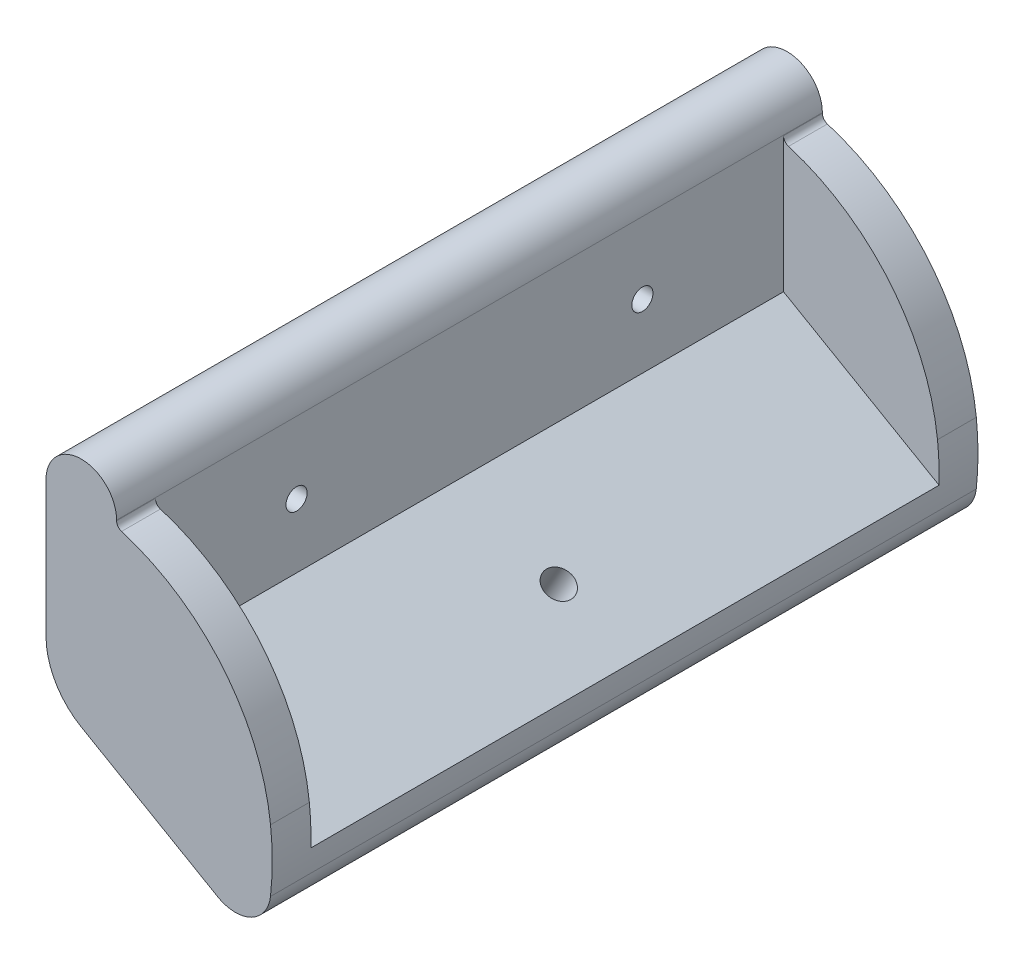
from build123d import *

# Parameters (mm, degrees)
BOSS_EXTRU_1_DEPTH      = 100
ESQUISSE3_R             = 2
ENL_V_MAT_EXTRU_2_DEPTH = 115.052675119
ESQUISSE7_W             = 5.5
ESQUISSE7_H             = 20.980762114
BOSS_EXTRU_3_DEPTH      = 29.226497
BOSS_EXTRU_4_OUTLINE_W  = 5.5
BOSS_EXTRU_4_OUTLINE_H  = 18.169872981
BOSS_EXTRU_4_DEPTH      = 10.490381057
CONG_2_R                = 40
CONG_3_R                = 40
CONG_4_R                = 5
CONG_5_RADIUS           = 5
CONG_5_LENGTH           = 100
ESQUISSE9_R             = 1.5
ENL_V_MAT_EXTRU_3_DEPTH = 112.741489915
CONG_6_R                = 1
CONG_7_R                = 1
CONG_8_R                = 30


# Read off the part's stored shape, not the designer's step: Boss.-Extru.4
with BuildPart() as part:
    # Esquisse1 → Boss.-Extru.1 (new body)
    with BuildSketch(Plane.XY):
        with BuildLine():
            Line((0, 0), (0, -24.226497308))
            ThreePointArc((0, -24.226497308), (1.339745962, -29.226497308), (5, -32.886751346))
            Line((5, -32.886751346), (30.310889132, -47.5))
            Line((30.310889132, -47.5), (35.310889132, -38.839745962))
            Line((35.310889132, -38.839745962), (10, -24.226497308))
            Line((10, -24.226497308), (10, 0))
            Line((10, 0), (0, 0))
        make_face()
    extrude(amount=BOSS_EXTRU_1_DEPTH)

    # Esquisse3 → Enlèv. mat.-Extru.2 (cut, through all)
    with BuildSketch(Plane(origin=(-7.990381057, -13.839745962, 0), x_dir=(0.86602540378444, -0.4999999999999978, 0), z_dir=(0.4999999999999978, 0.86602540378444, 0))):
        with Locations(Location((35.386751346, -50, 0), (0, 0, 180))):
            Circle(ESQUISSE3_R)
    extrude(amount=-ENL_V_MAT_EXTRU_2_DEPTH, mode=Mode.SUBTRACT)

    # Esquisse7 → Boss.-Extru.3 (add)
    with BuildSketch(Plane(origin=(43.301270189, -25, 0), x_dir=(0, 0, -1), z_dir=(0.86602540378444, -0.49999999999999756, 0))):
        with Locations((-97.25, -5.490381057)):
            Rectangle(ESQUISSE7_W, ESQUISSE7_H)
        with Locations((-2.75, -5.490381057)):
            Rectangle(ESQUISSE7_W, ESQUISSE7_H)
    extrude(amount=-BOSS_EXTRU_3_DEPTH)

    # Boss.-Extru.4 outline → Boss.-Extru.4 (add)
    with BuildSketch(Plane(origin=(10, 0, 0), x_dir=(0, 0, -1), z_dir=(1, 0, 0))):
        with Locations((-2.75, -15.141560818)):
            Rectangle(BOSS_EXTRU_4_OUTLINE_W, BOSS_EXTRU_4_OUTLINE_H)
        with Locations((-97.25, -15.141560818)):
            Rectangle(BOSS_EXTRU_4_OUTLINE_W, BOSS_EXTRU_4_OUTLINE_H)
    extrude(amount=BOSS_EXTRU_4_DEPTH)

    # Congé2
    # the kernel refuses this fillet: 40 mm, written as the material it takes off along each edge
    with BuildSketch(Plane(origin=(20.490381057, -6.056624327, 32.29491991), x_dir=(-1, 0, 0), z_dir=(0, 0, -1))) as cong_2_piece_1_section:
        with BuildLine():
            CenterArc((CONG_2_R * 0.267949192431, -CONG_2_R), CONG_2_R, 90, 30)
            Line((-CONG_2_R * 0.232050807569, -CONG_2_R * 0.133974596216), (0, 0))
            Line((0, 0), (CONG_2_R * 0.267949192431, 0))
        make_face()
    cong_2_piece_1 = extrude(amount=59.089839821, mode=Mode.PRIVATE)
    cong_2_piece_1 = split(cong_2_piece_1, bisect_by=Plane(origin=(10, -7.066001807, 2.75), z_dir=(1, 0, 0)), keep=Keep.TOP, mode=Mode.PRIVATE)
    add(cong_2_piece_1, mode=Mode.SUBTRACT)
    with BuildSketch(Plane(origin=(20.490381057, -6.056624327, 67.70508009), x_dir=(-1, 0, 0), z_dir=(0, 0, 1))) as cong_2_piece_2_section:
        with BuildLine():
            CenterArc((CONG_2_R * 0.267949192431, CONG_2_R), CONG_2_R, 240, 30)
            Line((-CONG_2_R * 0.232050807569, CONG_2_R * 0.133974596216), (0, 0))
            Line((0, 0), (CONG_2_R * 0.267949192431, 0))
        make_face()
    cong_2_piece_2 = extrude(amount=59.089839821, mode=Mode.PRIVATE)
    cong_2_piece_2 = split(cong_2_piece_2, bisect_by=Plane(origin=(10, -7.066001807, 97.25), z_dir=(1, 0, 0)), keep=Keep.TOP, mode=Mode.PRIVATE)
    add(cong_2_piece_2, mode=Mode.SUBTRACT)

    # Congé3
    # the kernel refuses this fillet: 40 mm, written as the material it takes off along each edge
    with BuildSketch(Plane(origin=(45.801270189, -20.669872981, -2.92475776), x_dir=(-0.8660254037844402, 0.49999999999999756, 0), z_dir=(0, 0, 1))) as cong_3_piece_1:
        with BuildLine():
            CenterArc((38.969903104, 40), CONG_3_R, 193.031161189, 76.968838811)
            Line((0, 30.980762114), (-0.779398062, 30.800377356))
            ThreePointArc((-0.779398062, 30.800377356), (-0.8, 15.490381057), (-0.8, 0))
            Line((-0.8, 0), (0, -0.8))
            Line((0, -0.8), (38.969903104, -0.8))
            Line((38.969903104, -0.8), (38.969903104, 0))
        make_face()
    extrude(amount=200.349515521, mode=Mode.SUBTRACT)

    # Congé4
    cong_4_edges = [part.edges().sort_by_distance(p)[0] for p in [
        (30.310889132, -47.5, 50),
    ]]
    fillet(cong_4_edges, radius=CONG_4_R)

    # Congé5: full round fillet: the end face becomes a half cylinder, R = half its width
    cong_5_face = Plane((5, 0, 50), x_dir=(0, 0, -1), z_dir=(0, 1, 0))  # on the end face: x along it, z out of the body
    cong_5_slab = cong_5_face.offset(-CONG_5_RADIUS / 2) * Box(CONG_5_LENGTH, 2 * CONG_5_RADIUS, CONG_5_RADIUS, mode=Mode.PRIVATE)  # the body's end, R deep
    cong_5_round = Plane((5, -5, 50), x_dir=(0, 1, 0), z_dir=(0, 0, -1)) * Cylinder(CONG_5_RADIUS, CONG_5_LENGTH, mode=Mode.PRIVATE)  # its axis R under the face
    add(cong_5_slab - cong_5_round, mode=Mode.SUBTRACT)

    # Esquisse9 → Enlèv. mat.-Extru.3 (cut, through all)
    with BuildSketch(Plane(origin=(10, 0, 0), x_dir=(0, 0, -1), z_dir=(1, 0, 0))):
        with Locations(Location((-74.5, -15.141560818, 0), (0, 0, 90))):
            Circle(ESQUISSE9_R)
        with Locations(Location((-25.5, -15.141560818, 0), (0, 0, 270))):
            Circle(ESQUISSE9_R)
    extrude(amount=-ENL_V_MAT_EXTRU_3_DEPTH, mode=Mode.SUBTRACT)

    # Congé6
    cong_6_edges = [part.edges().sort_by_distance(p)[0] for p in [
        (10, -6.057271778, 97.25),
    ]]
    fillet(cong_6_edges, radius=CONG_6_R)

    # Congé7
    cong_7_edges = [part.edges().sort_by_distance(p)[0] for p in [
        (10, -6.057271778, 2.75),
    ]]
    fillet(cong_7_edges, radius=CONG_7_R)

    # Congé8
    cong_8_edges = [part.edges().sort_by_distance(p)[0] for p in [
        (20.24714696, -7.452480042, 97.25),
        (20.24714696, -7.452480042, 2.75),
    ]]
    fillet(cong_8_edges, radius=CONG_8_R)


solid = part.part
